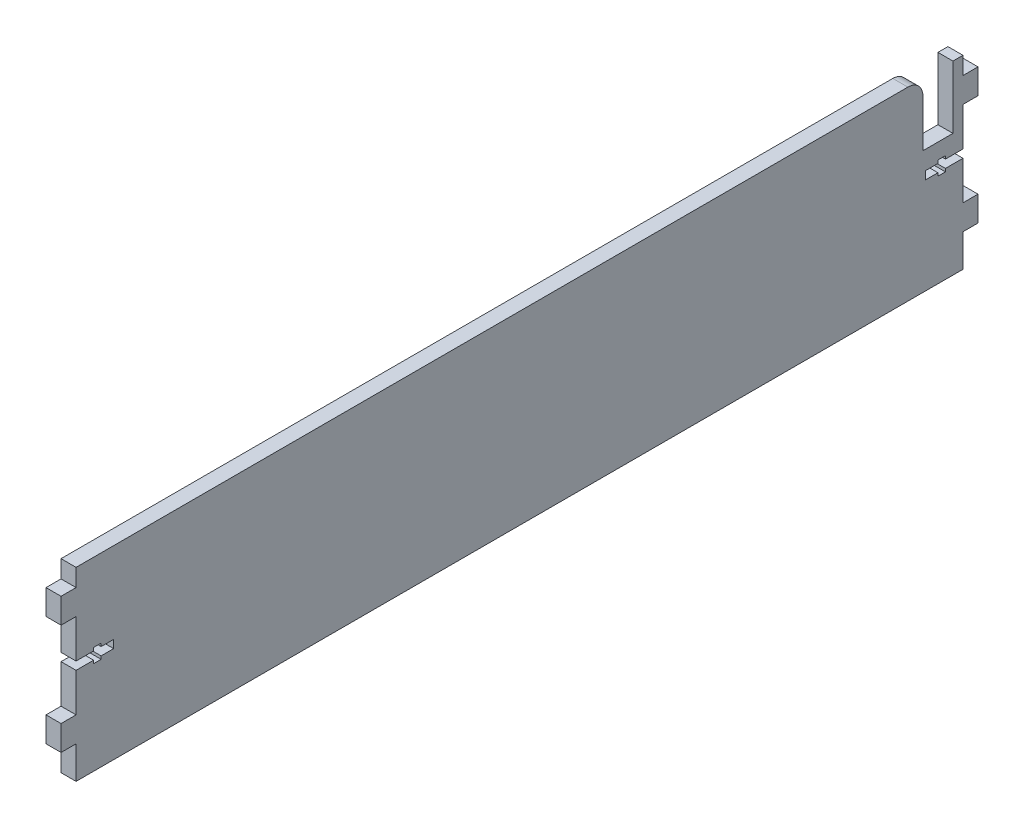
from build123d import *

# Parameters (mm, degrees)
SKETCH1_W           = 354
SKETCH1_H           = 80
BOSS_EXTRUDE1_DEPTH = 6
SKETCH4_W           = 6
SKETCH4_H           = 10
BOSS_EXTRUDE2_DEPTH = 6
CUT_EXTRUDE3_REACH  = 189.417
SKETCH7_W           = 6
SKETCH7_H           = 10
BOSS_EXTRUDE3_DEPTH = 6
SKETCH8_W           = 6
SKETCH8_H           = 354
CUT_EXTRUDE4_DEPTH  = 6
SKETCH9_W           = 6
SKETCH9_H           = 12
CUT_EXTRUDE5_DEPTH  = 25
FILLET1_R           = 6


with BuildPart() as part:
    # Sketch1 → Boss-Extrude1 (new body)
    with BuildSketch(Plane(origin=(0, 0, 0), x_dir=(0, 0, -1), z_dir=(1, 0, 0))):
        Rectangle(SKETCH1_W, SKETCH1_H)
    extrude(amount=BOSS_EXTRUDE1_DEPTH)

    # Sketch4 → Boss-Extrude2 (add)
    with BuildSketch(Plane.XY.offset(177)):
        with Locations((3, 22)):
            Rectangle(SKETCH4_W, SKETCH4_H)
        with Locations((3, -22)):
            Rectangle(SKETCH4_W, SKETCH4_H)
    extrude(amount=BOSS_EXTRUDE2_DEPTH)

    # Sketch5 → Cut-Extrude3 (cut, up to next)
    with BuildSketch(Plane.ZY, mode=Mode.PRIVATE) as cut_extrude3_sk1:
        Polygon((-170, 1.6), (-177, 1.6), (-177, -1.6), (-170, -1.6), (-170, -2.8), (-167, -2.8), (-167, -1.6), (-162, -1.6), (-162, 1.6), (-167, 1.6), (-167, 2.8), (-170, 2.8), align=None)
    cut_extrude3_tool1 = extrude(cut_extrude3_sk1.sketch, amount=-CUT_EXTRUDE3_REACH, mode=Mode.PRIVATE) & part.part
    # Sketch5 → Cut-Extrude3 (cut, up to next)
    with BuildSketch(Plane.ZY, mode=Mode.PRIVATE) as cut_extrude3_sk2:
        Polygon((170, -1.6), (177, -1.6), (177, 1.6), (170, 1.6), (170, 2.8), (167, 2.8), (167, 1.6), (162, 1.6), (162, -1.6), (167, -1.6), (167, -2.8), (170, -2.8), align=None)
    cut_extrude3_tool2 = extrude(cut_extrude3_sk2.sketch, amount=-CUT_EXTRUDE3_REACH, mode=Mode.PRIVATE) & part.part
    add(cut_extrude3_tool1.solids().sort_by_distance((0, 0, -169.369565))[0], mode=Mode.SUBTRACT)
    add(cut_extrude3_tool2.solids().sort_by_distance((0, 0, 169.369565))[0], mode=Mode.SUBTRACT)

    # Sketch7 → Boss-Extrude3 (add)
    with BuildSketch(Plane(origin=(0, 0, -177), x_dir=(-1, 0, 0), z_dir=(0, 0, -1))):
        with Locations((-3, 22)):
            Rectangle(SKETCH7_W, SKETCH7_H)
        with Locations((-3, -22)):
            Rectangle(SKETCH7_W, SKETCH7_H)
    extrude(amount=BOSS_EXTRUDE3_DEPTH)

    # Sketch8 → Cut-Extrude4 (cut)
    with BuildSketch(Plane(origin=(0, 40, 0), x_dir=(1, 0, 0), z_dir=(0, 1, 0))):
        with Locations((3, 0)):
            Rectangle(SKETCH8_W, SKETCH8_H)
    extrude(amount=-CUT_EXTRUDE4_DEPTH, mode=Mode.SUBTRACT)

    # Sketch9 → Cut-Extrude5 (cut)
    with BuildSketch(Plane(origin=(0, 34, 0), x_dir=(1, 0, 0), z_dir=(0, 1, 0))):
        with Locations((3, 167)):
            Rectangle(SKETCH9_W, SKETCH9_H)
    extrude(amount=-CUT_EXTRUDE5_DEPTH, mode=Mode.SUBTRACT)

    # Fillet1
    fillet1_edges = [part.edges().sort_by_distance(p)[0] for p in [
        (3, 34, -161),
    ]]
    fillet(fillet1_edges, radius=FILLET1_R)


solid = part.part
